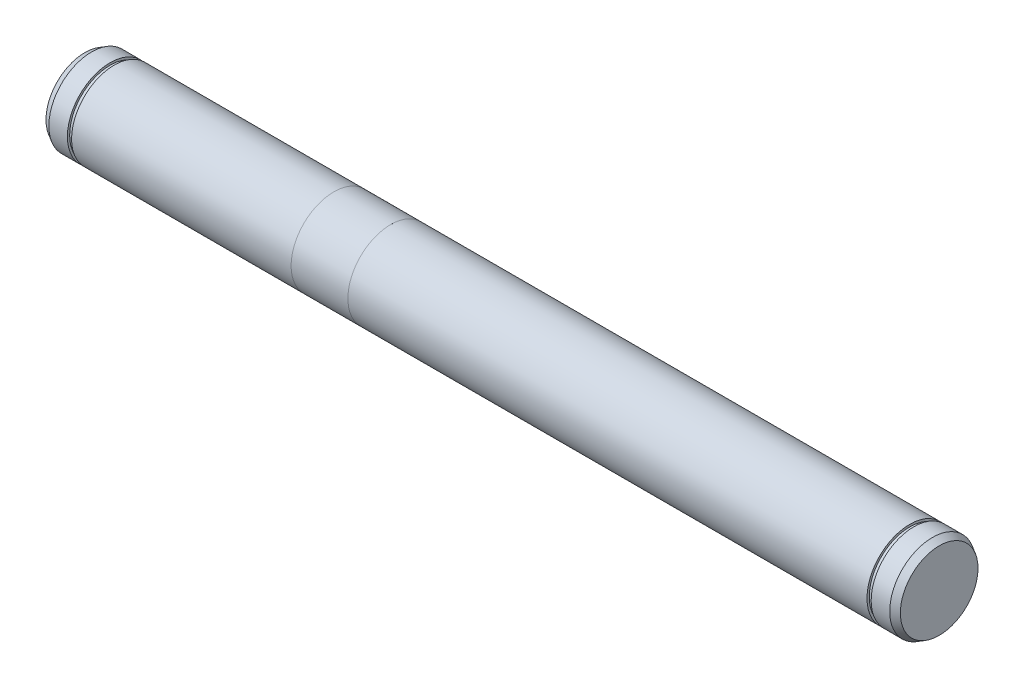
from build123d import *
from OCP.BRepFilletAPI import BRepFilletAPI_MakeChamfer

# Parameters (mm, degrees)
SKIZZE19_W      = 1.85
SKIZZE19_H      = 1
SKIZZE20_W      = 1.85
SKIZZE20_H      = 1
SKETCH1_W       = 14.101371306
SKETCH1_H       = 11.293421516
CHAMFER_1_SIZE  = 3
CHAMFER_1_SIZE2 = 1.732050808


with BuildPart() as part:
    # Skizze1 → Rotation1 (revolve)
    with BuildSketch(Plane.XY):
        Polygon((190, 19), (190, 0), (-190, 0), (-190, 19), (-89, 19), (-89, 27), (-84, 27), (-84, 19.001), (-54, 19.001), (-54, 19), align=None)
    revolve(axis=Axis((190, 0, 0), (-1, 0, 0)))

    # Skizze19 → Schnitt-Rotation1 (revolve, cut)
    with BuildSketch(Plane.XY):
        with Locations((177.825, 18.5)):
            Rectangle(SKIZZE19_W, SKIZZE19_H)
    revolve(axis=Axis((-88.99, 0, 0), (1, 0, 0)), mode=Mode.SUBTRACT)

    # Skizze20 → Schnitt-Rotation2 (revolve, cut)
    with BuildSketch(Plane.XY):
        with Locations((-177.825, 18.5)):
            Rectangle(SKIZZE20_W, SKIZZE20_H)
    revolve(axis=Axis((-88.99, 0, 0), (1, 0, 0)), mode=Mode.SUBTRACT)

    # Sketch1 → Cut-Revolve1 (revolve, cut)
    with BuildSketch(Plane.XY):
        with Locations((-86.280304753, 24.646710758)):
            Rectangle(SKETCH1_W, SKETCH1_H)
    revolve(axis=Axis((-191.164691911, 0, 0), (1, 0, 0)), mode=Mode.SUBTRACT)

    # 倒角1: one chamfer whose edges measure the first distance from different faces: ONE call of the kernel's chamfer builder (chamfer() names one face for all edges)
    chamfer_1_edges_1 = [part.edges().sort_by_distance(p)[0] for p in [
        (190, -19, 0),
    ]]
    chamfer_1_side_1 = [part.faces().sort_by_distance(p)[0] for p in [
        (184.375, -19, 0),
    ]]
    chamfer_1_edges_2 = [part.edges().sort_by_distance(p)[0] for p in [
        (-190, -19, 0),
    ]]
    chamfer_1_side_2 = [part.faces().sort_by_distance(p)[0] for p in [
        (-184.375, -19, 0),
    ]]
    chamfer_1 = BRepFilletAPI_MakeChamfer(part.part.solid().wrapped)
    for e in chamfer_1_edges_1:
        chamfer_1.Add(CHAMFER_1_SIZE, CHAMFER_1_SIZE2, e.wrapped, chamfer_1_side_1[0].wrapped)  # the first distance lies on this face
    for e in chamfer_1_edges_2:
        chamfer_1.Add(CHAMFER_1_SIZE, CHAMFER_1_SIZE2, e.wrapped, chamfer_1_side_2[0].wrapped)  # the first distance lies on this face
    add(Compound.cast(chamfer_1.Shape()), mode=Mode.REPLACE)


solid = part.part
